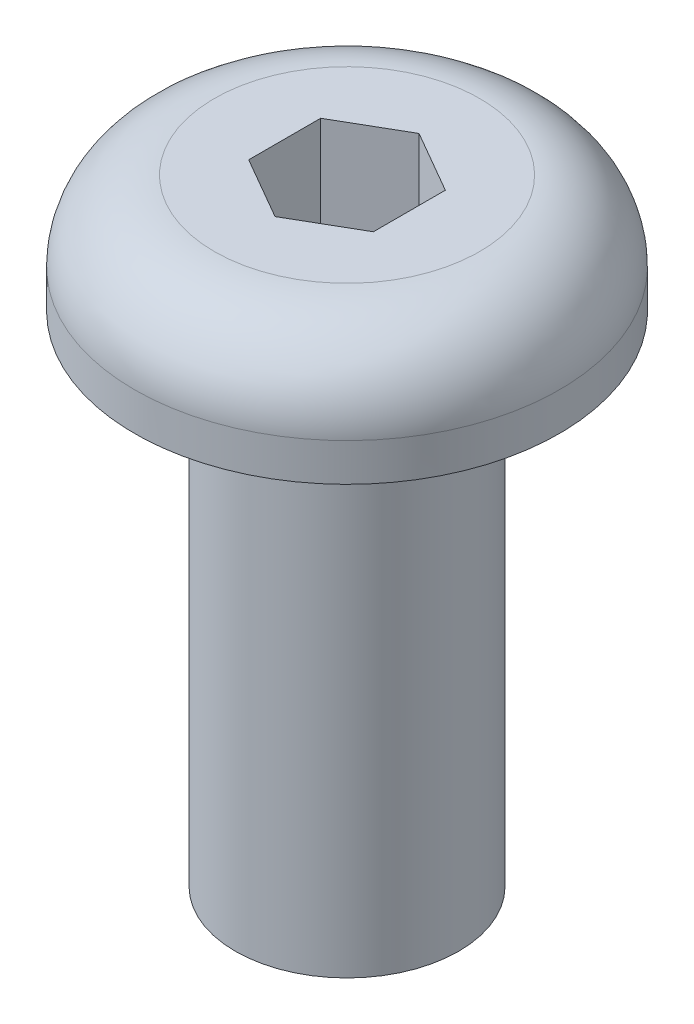
from build123d import *

# Parameters (mm, degrees)
SKETCH1_R           = 1.4224
BOSS_EXTRUDE1_DEPTH = 6.35
SKETCH2_R           = 2.7051
BOSS_EXTRUDE2_DEPTH = 1.4986
FILLET1_R           = 1.016
CUT_EXTRUDE1_DEPTH  = 2.38125


with BuildPart() as part:
    # Sketch1 → Boss-Extrude1 (new body)
    with BuildSketch(Plane(origin=(0, 0, 0), x_dir=(1, 0, 0), z_dir=(0, 1, 0))):
        Circle(SKETCH1_R)
    extrude(amount=BOSS_EXTRUDE1_DEPTH)

    # Sketch2 → Boss-Extrude2 (add)
    with BuildSketch(Plane(origin=(0, 6.35, 0), x_dir=(1, 0, 0), z_dir=(0, 1, 0))):
        Circle(SKETCH2_R)
    extrude(amount=BOSS_EXTRUDE2_DEPTH)

    # Fillet1
    fillet1_edges = [part.edges().sort_by_distance(p)[0] for p in [
        (-2.7051, 7.8486, 0),
    ]]
    fillet(fillet1_edges, radius=FILLET1_R)

    # Sketch3 → Cut-Extrude1 (cut)
    with BuildSketch(Plane(origin=(0, 7.8486, 0), x_dir=(1, 0, 0), z_dir=(0, 1, 0))):
        Polygon((0, 0.916543552), (-0.79375, 0.458271776), (-0.79375, -0.458271776), (0, -0.916543552), (0.79375, -0.458271776), (0.79375, 0.458271776), align=None)
    extrude(amount=-CUT_EXTRUDE1_DEPTH, mode=Mode.SUBTRACT)


solid = part.part
